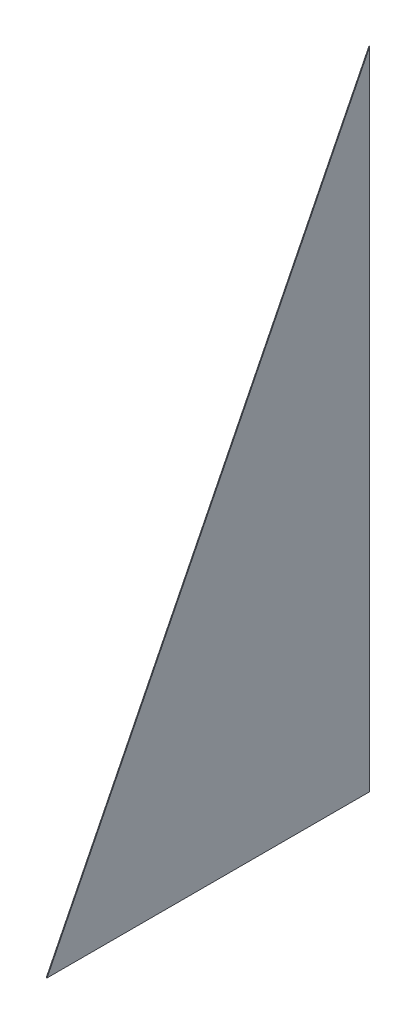
from build123d import *

# Parameters (mm, degrees)
BOSS_EXTRUDE1_DEPTH = 1


with BuildPart() as part:
    # Sketch1 → Boss-Extrude1 (new body)
    with BuildSketch(Plane(origin=(0, 0, 0), x_dir=(0, 0, -1), z_dir=(1, 0, 0))):
        Polygon((0, 0), (0, 800), (-400, 0), align=None)
    extrude(amount=BOSS_EXTRUDE1_DEPTH)


solid = part.part
